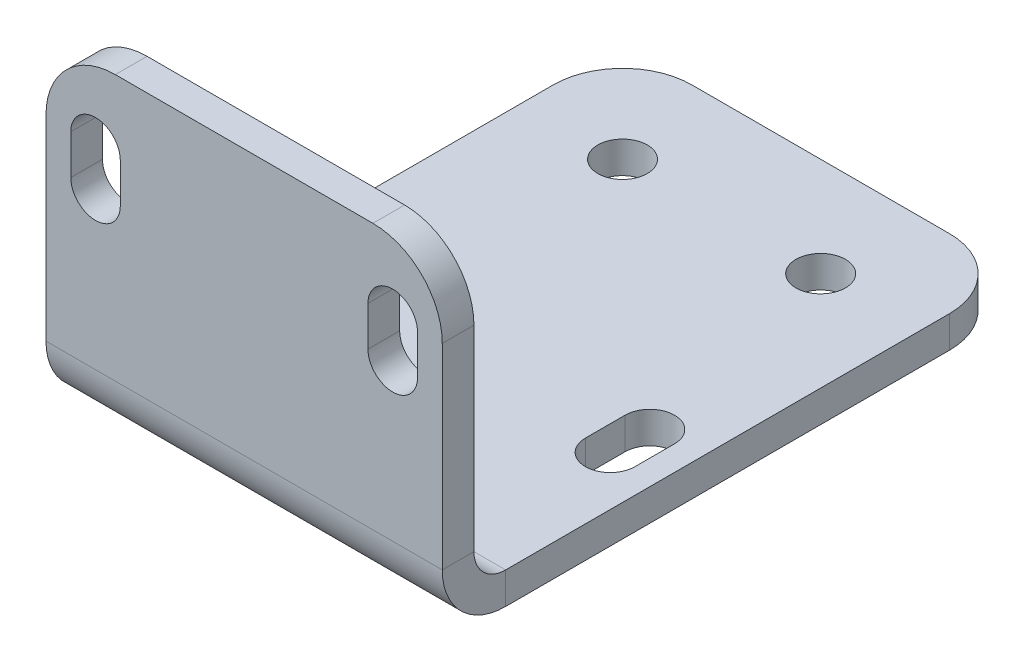
from build123d import *

# Parameters (mm, degrees)
SKETCH1_W                  = 39.999999999
SKETCH1_H                  = 30
BOSS_EXTRUDE1_DEPTH        = 3.175
SKETCH3_W                  = 3.175
SKETCH3_H                  = 3.175
SKETCH3_W_2                = 25
BOSS_EXTRUDE2_DEPTH        = 40
SKETCH4_R                  = 2.5
CUT_EXTRUDE1_DEPTH         = 10
FILLET1_R                  = 7
CONVERT_SOLID1_START       = -32.140684808
CONVERT_SOLID1_OUTLINE_R   = 2.5
CONVERT_SOLID1_DEPTH       = 5.340684808
CONVERT_SOLID1_START_2     = -33.2
CONVERT_SOLID1_2_OUTLINE_R = 2.5
CONVERT_SOLID1_2_DEPTH     = 0.025
CONVERT_SOLID1_START_3     = -27.475968
CONVERT_SOLID1_3_OUTLINE_W = 39.999999999
CONVERT_SOLID1_3_OUTLINE_H = 0.025
CONVERT_SOLID1_3_DEPTH     = 27.475968
CONVERT_SOLID1_START_4     = 31.592932584
CONVERT_SOLID1_4_DEPTH     = 39.999999999
CONVERT_SOLID1_START_5     = -49
CONVERT_SOLID1_5_OUTLINE_W = 39.999999999
CONVERT_SOLID1_5_OUTLINE_H = 3.2
CONVERT_SOLID1_5_DEPTH     = 2.85856
CONVERT_SOLID1_START_6     = 3.175
CONVERT_SOLID1_6_DEPTH     = 0.825


with BuildPart() as part:
    # Sketch1 → Boss-Extrude1 (new body)
    with BuildSketch(Plane.XY):
        with Locations((51.592932584, -15)):
            Rectangle(SKETCH1_W, SKETCH1_H)
        with BuildLine():
            Line((34.092932584, -11.25), (34.092932584, -7.25))
            ThreePointArc((34.092932584, -7.25), (36.592932584, -4.75), (39.092932584, -7.25))
            Line((39.092932584, -7.25), (39.092932584, -11.25))
            ThreePointArc((39.092932584, -11.25), (36.592932584, -13.75), (34.092932584, -11.25))
        make_face(mode=Mode.SUBTRACT)
        with BuildLine():
            Line((64.092932583, -11.25), (64.092932583, -7.25))
            ThreePointArc((64.092932583, -7.25), (66.592932583, -4.75), (69.092932583, -7.25))
            Line((69.092932583, -7.25), (69.092932583, -11.25))
            ThreePointArc((69.092932583, -11.25), (66.592932583, -13.75), (64.092932583, -11.25))
        make_face(mode=Mode.SUBTRACT)
    extrude(amount=BOSS_EXTRUDE1_DEPTH)


with BuildPart() as body_2:
    # Mirror1: mirrored copy
    add(part.part.mirror(Plane(origin=(0, -15, -15), x_dir=(0, -0.7071067811865465, 0.7071067811865486), z_dir=(0, -0.7071067811865488, -0.7071067811865464))))


with BuildPart() as part_1:
    add(part.part)

    add(body_2.part)  # Boss-Extrude2 merges body 2
    # Sketch3 → Boss-Extrude2 (add, through all)
    with BuildSketch(Plane(origin=(71.592932583, 0, 0), x_dir=(0, 0, -1), z_dir=(1, 0, 0))):
        with Locations((-1.5875, -31.5875)):
            Rectangle(SKETCH3_W, SKETCH3_H)
        with Locations((42.5, -31.5875)):
            Rectangle(SKETCH3_W_2, SKETCH3_H)
    extrude(amount=-BOSS_EXTRUDE2_DEPTH)

    # Sketch4 → Cut-Extrude1 (cut)
    with BuildSketch(Plane.XZ.offset(33.175)):
        with Locations((61.592932583, -45)):
            Circle(SKETCH4_R)
        with Locations((41.592932584, -45)):
            Circle(SKETCH4_R)
    extrude(amount=-CUT_EXTRUDE1_DEPTH, mode=Mode.SUBTRACT)

    # Fillet1
    fillet1_edges = [part_1.edges().sort_by_distance(p)[0] for p in [
        (31.592932584, 0, 1.5875),
        (71.592932583, 0, 1.5875),
        (71.592932583, -31.5875, -55),
        (31.592932583, -31.5875, -55),
    ]]
    fillet(fillet1_edges, radius=FILLET1_R)

    # Convert-Solid1: read off the stored shape, not the designer's step
    # Convert-Solid1 outline → Convert-Solid1 (add)
    with BuildSketch(Plane(origin=(0, 0, 0), x_dir=(1, 0, 0), z_dir=(0, 1, 0)).offset(CONVERT_SOLID1_START)):
        with BuildLine():
            Line((31.592932584, 48), (31.592932584, 0))
            Line((31.592932584, 0), (71.592932583, 0))
            Line((71.592932583, 0), (71.592932583, 48))
            ThreePointArc((71.592932583, 48), (69.542680051, 52.949747468), (64.592932583, 55))
            Line((64.592932583, 55), (38.592932584, 55))
            ThreePointArc((38.592932584, 55), (33.643185116, 52.949747469), (31.592932584, 48))
        make_face()
        with BuildLine():
            ThreePointArc((34.092932584, 22.75), (36.592932584, 25.25), (39.092932584, 22.75))
            Line((39.092932584, 22.75), (39.092932584, 18.75))
            ThreePointArc((39.092932584, 18.75), (36.592932584, 16.25), (34.092932584, 18.75))
            Line((34.092932584, 18.75), (34.092932584, 22.75))
        make_face(mode=Mode.SUBTRACT)
        with BuildLine():
            ThreePointArc((64.092932583, 22.75), (66.592932583, 25.25), (69.092932583, 22.75))
            Line((69.092932583, 22.75), (69.092932583, 18.75))
            ThreePointArc((69.092932583, 18.75), (66.592932583, 16.25), (64.092932583, 18.75))
            Line((64.092932583, 18.75), (64.092932583, 22.75))
        make_face(mode=Mode.SUBTRACT)
        with Locations((41.592932584, 45)):
            Circle(CONVERT_SOLID1_OUTLINE_R, mode=Mode.SUBTRACT)
        with Locations((61.592932583, 45)):
            Circle(CONVERT_SOLID1_OUTLINE_R, mode=Mode.SUBTRACT)
    extrude(amount=CONVERT_SOLID1_DEPTH)

    # Convert-Solid1 2 outline → Convert-Solid1 2 (add)
    with BuildSketch(Plane(origin=(0, 0, 0), x_dir=(1, 0, 0), z_dir=(0, 1, 0)).offset(CONVERT_SOLID1_START_2)):
        with BuildLine():
            Line((31.592932584, 48), (31.592932584, 0))
            Line((31.592932584, 0), (71.592932583, 0))
            Line((71.592932583, 0), (71.592932583, 48))
            ThreePointArc((71.592932583, 48), (69.542680051, 52.949747468), (64.592932583, 55))
            Line((64.592932583, 55), (38.592932584, 55))
            ThreePointArc((38.592932584, 55), (33.643185116, 52.949747469), (31.592932584, 48))
        make_face()
        with BuildLine():
            ThreePointArc((34.092932584, 22.75), (36.592932584, 25.25), (39.092932584, 22.75))
            Line((39.092932584, 22.75), (39.092932584, 18.75))
            ThreePointArc((39.092932584, 18.75), (36.592932584, 16.25), (34.092932584, 18.75))
            Line((34.092932584, 18.75), (34.092932584, 22.75))
        make_face(mode=Mode.SUBTRACT)
        with BuildLine():
            ThreePointArc((64.092932583, 22.75), (66.592932583, 25.25), (69.092932583, 22.75))
            Line((69.092932583, 22.75), (69.092932583, 18.75))
            ThreePointArc((69.092932583, 18.75), (66.592932583, 16.25), (64.092932583, 18.75))
            Line((64.092932583, 18.75), (64.092932583, 22.75))
        make_face(mode=Mode.SUBTRACT)
        with Locations((41.592932584, 45)):
            Circle(CONVERT_SOLID1_2_OUTLINE_R, mode=Mode.SUBTRACT)
        with Locations((61.592932583, 45)):
            Circle(CONVERT_SOLID1_2_OUTLINE_R, mode=Mode.SUBTRACT)
    extrude(amount=CONVERT_SOLID1_2_DEPTH)

    # Convert-Solid1 3 outline → Convert-Solid1 3 (add)
    with BuildSketch(Plane(origin=(0, 0, 0), x_dir=(1, 0, 0), z_dir=(0, 1, 0)).offset(CONVERT_SOLID1_START_3)):
        with Locations((51.592932584, -3.1875)):
            Rectangle(CONVERT_SOLID1_3_OUTLINE_W, CONVERT_SOLID1_3_OUTLINE_H)
    extrude(amount=CONVERT_SOLID1_3_DEPTH)

    # Convert-Solid1 4 outline → Convert-Solid1 4 (cut)
    with BuildSketch(Plane.YZ.offset(CONVERT_SOLID1_START_4)):
        with BuildLine():
            ThreePointArc((-26.8, 0), (-29.0627417, -0.9372583), (-30, -3.2))
            Line((-30, -3.2), (-30, -55))
            Line((-30, -55), (-26.8, -55))
            Line((-26.8, -55), (-26.8, 0))
        make_face()
        with BuildLine():
            Line((-33.2, 0), (-33.2, -3.2))
            ThreePointArc((-33.2, -3.2), (-31.3254834, 1.3254834), (-26.8, 3.2))
            Line((-26.8, 3.2), (-27.475968, 3.2))
            Line((-27.475968, 3.2), (-27.475968, 3.175))
            Line((-27.475968, 3.175), (-33.175, 3.175))
            Line((-33.175, 3.175), (-33.175, 0))
            Line((-33.175, 0), (-33.2, 0))
        make_face()
    extrude(amount=CONVERT_SOLID1_4_DEPTH, mode=Mode.SUBTRACT)

    # Convert-Solid1 5 outline → Convert-Solid1 5 (cut)
    with BuildSketch(Plane.XY.offset(CONVERT_SOLID1_START_5)):
        with Locations((51.592932584, -28.4)):
            Rectangle(CONVERT_SOLID1_5_OUTLINE_W, CONVERT_SOLID1_5_OUTLINE_H)
    extrude(amount=CONVERT_SOLID1_5_DEPTH, mode=Mode.SUBTRACT)

    # Convert-Solid1 6 outline → Convert-Solid1 6 (cut)
    with BuildSketch(Plane.XY.offset(CONVERT_SOLID1_START_6)):
        with BuildLine():
            Line((71.592932583, -7), (71.592932583, 0))
            Line((71.592932583, 0), (64.592932583, 0))
            ThreePointArc((64.592932583, 0), (69.542680051, -2.050252532), (71.592932583, -7))
        make_face()
        with BuildLine():
            ThreePointArc((31.592932584, -7), (33.643185116, -2.050252531), (38.592932584, 0))
            Line((38.592932584, 0), (31.592932584, 0))
            Line((31.592932584, 0), (31.592932584, -7))
        make_face()
        with BuildLine():
            ThreePointArc((64.092932583, -11.25), (66.592932583, -13.75), (69.092932583, -11.25))
            Line((69.092932583, -11.25), (69.092932583, -7.25))
            ThreePointArc((69.092932583, -7.25), (66.592932583, -4.75), (64.092932583, -7.25))
            Line((64.092932583, -7.25), (64.092932583, -11.25))
        make_face()
        with BuildLine():
            ThreePointArc((34.092932584, -11.25), (36.592932584, -13.75), (39.092932584, -11.25))
            Line((39.092932584, -11.25), (39.092932584, -7.25))
            ThreePointArc((39.092932584, -7.25), (36.592932584, -4.75), (34.092932584, -7.25))
            Line((34.092932584, -7.25), (34.092932584, -11.25))
        make_face()
    extrude(amount=CONVERT_SOLID1_6_DEPTH, mode=Mode.SUBTRACT)


solid = part_1.part
